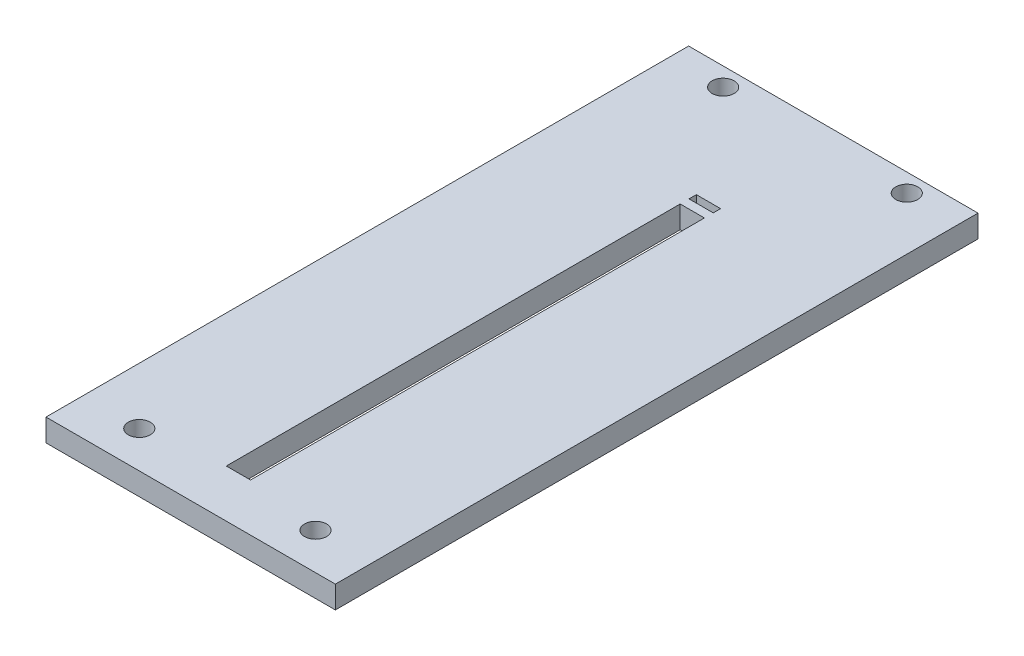
from build123d import *

# Parameters (mm, degrees)
SKETCH1_W             = 39.4
SKETCH1_H             = 87.5
BOSS_EXTRUDE1_DEPTH   = 3.05
SKETCH4_W             = 3.3
SKETCH4_H             = 1
SKETCH4_H_2           = 61.8
CUT_EXTRUDE1_DEPTH    = 90.742088788
SKETCH7_R             = 1.5
CUT_EXTRUDE4_DEPTH    = 90.742088788
F_3_0MM_DOWEL_HOLE1_D = 3


with BuildPart() as part:
    # Sketch1 → Boss-Extrude1 (new body)
    with BuildSketch(Plane(origin=(0, 0, 0), x_dir=(1, 0, 0), z_dir=(0, 1, 0))):
        with Locations((0, 43.75)):
            Rectangle(SKETCH1_W, SKETCH1_H)
    extrude(amount=BOSS_EXTRUDE1_DEPTH)

    # Sketch4 → Cut-Extrude1 (cut, through all)
    with BuildSketch(Plane(origin=(0, 3.05, 0), x_dir=(1, 0, 0), z_dir=(0, 1, 0))):
        with Locations((0, 70)):
            Rectangle(SKETCH4_W, SKETCH4_H)
        with Locations((0, 37.4)):
            Rectangle(SKETCH4_W, SKETCH4_H_2)
    extrude(amount=-CUT_EXTRUDE1_DEPTH, mode=Mode.SUBTRACT)

    # Sketch7 → Cut-Extrude4 (cut, through all)
    with BuildSketch(Plane(origin=(0, 3.05, 0), x_dir=(1, 0, 0), z_dir=(0, 1, 0))):
        with Locations((-12, 5)):
            Circle(SKETCH7_R)
        with Locations((12, 5)):
            Circle(SKETCH7_R)
    extrude(amount=-CUT_EXTRUDE4_DEPTH, mode=Mode.SUBTRACT)

    # Ø3.0mm Dowel Hole1 (through all)
    with Locations(Plane(origin=(0, 3.05, 0), x_dir=(1, 0, 0), z_dir=(0, 1, 0))):
        with Locations((-12.5, 85), (12.5, 85)):
            Hole(F_3_0MM_DOWEL_HOLE1_D / 2)


solid = part.part
